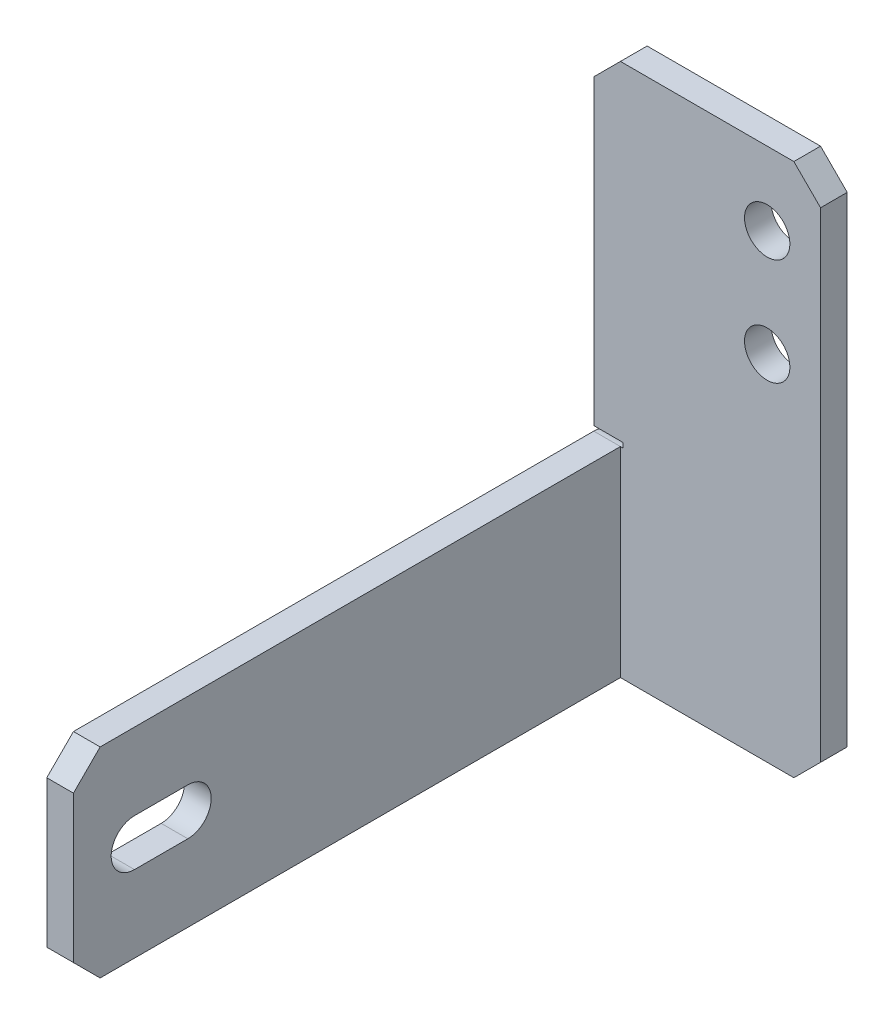
from build123d import *

# Parameters (mm, degrees)
SKETCH1_R           = 1.7
BOSS_EXTRUDE1_DEPTH = 2
SKETCH2_W           = 2
SKETCH2_H           = 15
BOSS_EXTRUDE2_DEPTH = 41
CUT_EXTRUDE1_DEPTH  = 52.818254684
FILLET1_R           = 2
CHAMFER1_SIZE       = 2


with BuildPart() as part:
    # Sketch1 → Boss-Extrude1 (new body)
    with BuildSketch(Plane.XY):
        Polygon((-8.078512397, -9.72107438), (-8.078512397, -24.72107438), (8.921487603, -24.72107438), (8.921487603, 15.27892562), (-8.078512397, 15.27892562), (-8.078512397, -9.36189554), (-5.878512397, -9.36189554), (-5.878512397, -9.72107438), align=None)
        with Locations((4.921487603, 9.77892562)):
            Circle(SKETCH1_R, mode=Mode.SUBTRACT)
        with Locations((4.921487603, 1.77892562)):
            Circle(SKETCH1_R, mode=Mode.SUBTRACT)
    extrude(amount=BOSS_EXTRUDE1_DEPTH)

    # Sketch2 → Boss-Extrude2 (add)
    with BuildSketch(Plane.XY.offset(2)):
        with Locations((-7.078512397, -17.22107438)):
            Rectangle(SKETCH2_W, SKETCH2_H)
    extrude(amount=BOSS_EXTRUDE2_DEPTH)

    # Sketch3 → Cut-Extrude1 (cut, through all)
    with BuildSketch(Plane(origin=(-6.078512397, 0, 0), x_dir=(0, 0, -1), z_dir=(1, 0, 0))):
        with BuildLine():
            Line((-38.423728751, -15.47107438), (-34.423728751, -15.47107438))
            ThreePointArc((-34.423728751, -15.47107438), (-32.673728751, -17.22107438), (-34.423728751, -18.97107438))
            Line((-34.423728751, -18.97107438), (-38.423728751, -18.97107438))
            ThreePointArc((-38.423728751, -18.97107438), (-40.173728751, -17.22107438), (-38.423728751, -15.47107438))
        make_face()
    extrude(amount=-CUT_EXTRUDE1_DEPTH, mode=Mode.SUBTRACT)

    # Fillet1
    fillet1_edges = [part.edges().sort_by_distance(p)[0] for p in [
        (-6.978512397, -9.72107438, 0),
    ]]
    fillet(fillet1_edges, radius=FILLET1_R - 0.0001)  # a hair under: the kernel refuses the full size

    # Chamfer1
    chamfer1_edges = [part.edges().sort_by_distance(p)[0] for p in [
        (-8.078512397, 15.27892562, 1),
        (8.921487603, 15.27892562, 1),
        (8.921487603, -24.72107438, 1),
        (-7.078512397, -24.72107438, 43),
        (-7.078512397, -9.72107438, 43),
    ]]
    chamfer(chamfer1_edges, length=CHAMFER1_SIZE)


solid = part.part
